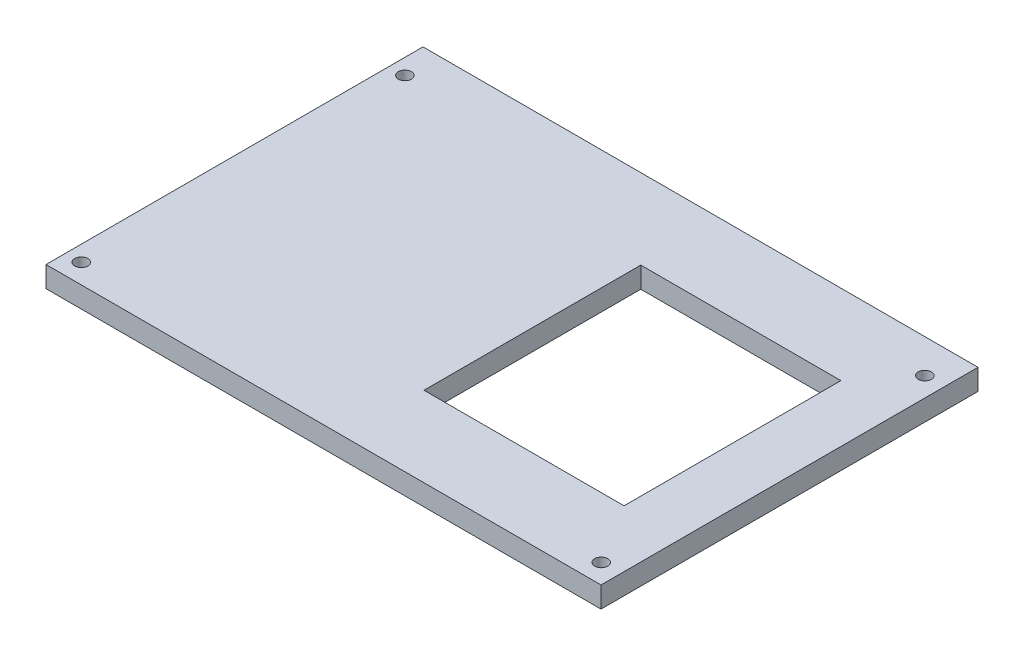
from build123d import *

# Parameters (mm, degrees)
SKETCH2_W           = 106
SKETCH2_H           = 4
BOSS_EXTRUDE1_DEPTH = 72
SKETCH4_R           = 1.25
CUT_EXTRUDE1_DEPTH  = 90.493016487
SKETCH5_R           = 1.75
CUT_EXTRUDE2_DEPTH  = 10
SKETCH6_W           = 38.22100301
SKETCH6_H           = 41.408309334
CUT_EXTRUDE3_DEPTH  = 10


with BuildPart() as part:
    # Sketch2 → Boss-Extrude1 (new body)
    with BuildSketch(Plane.XY):
        Rectangle(SKETCH2_W, SKETCH2_H)
    extrude(amount=BOSS_EXTRUDE1_DEPTH)

    # Sketch4 → Cut-Extrude1 (cut, through all)
    with BuildSketch(Plane(origin=(0, 2, 0), x_dir=(1, 0, 0), z_dir=(0, 1, 0))):
        with Locations((-50.004878073, -68.250693227)):
            Circle(SKETCH4_R)
        with Locations((49.295121927, -68.250693227)):
            Circle(SKETCH4_R)
        with Locations((49.295121927, -6.450693227)):
            Circle(SKETCH4_R)
        with Locations((-50.004878073, -6.450693227)):
            Circle(SKETCH4_R)
    extrude(amount=-CUT_EXTRUDE1_DEPTH, mode=Mode.SUBTRACT)

    # Sketch5 → Cut-Extrude2 (cut)
    with BuildSketch(Plane(origin=(0, 0, 0), x_dir=(-1, 0, 0), z_dir=(0, 0, -1))):
        Circle(SKETCH5_R)
        with Locations((26.5, 0)):
            Circle(SKETCH5_R)
        with Locations((-26.5, 0)):
            Circle(SKETCH5_R)
    extrude(amount=-CUT_EXTRUDE2_DEPTH, mode=Mode.SUBTRACT)

    # Sketch6 → Cut-Extrude3 (cut)
    with BuildSketch(Plane(origin=(0, 2, 0), x_dir=(1, 0, 0), z_dir=(0, 1, 0))):
        with Locations((23, -36)):
            Rectangle(SKETCH6_W, SKETCH6_H)
    extrude(amount=-CUT_EXTRUDE3_DEPTH, mode=Mode.SUBTRACT)


solid = part.part
